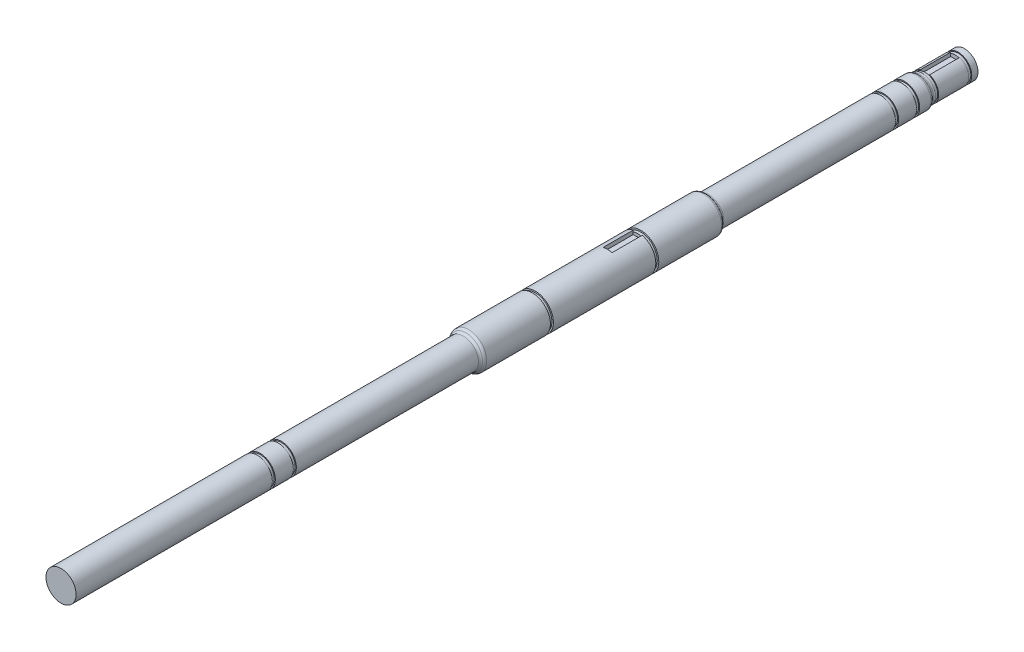
from build123d import *

# Parameters (mm, degrees)
SKETCH7_W           = 10
SKETCH7_H           = 1.5
CUT_EXTRUDE4_DEPTH  = 1.5
SKETCH8_W           = 10
SKETCH8_H           = 1.5
CUT_EXTRUDE5_DEPTH  = 1.5
SKETCH11_W          = 1
SKETCH11_H          = 0.35
SKETCH12_W          = 1
SKETCH12_H          = 0.35
SKETCH14_R          = 6
BOSS_EXTRUDE1_DEPTH = 20
BOSS_EXTRUDE2_START = 20
SKETCH15_R          = 6
BOSS_EXTRUDE2_DEPTH = 20
SKETCH18_W          = 1
SKETCH18_H          = 0.35
SKETCH19_W          = 1
SKETCH19_H          = 0.35
SKETCH22_W          = 0.996061345
SKETCH22_H          = 0.5
SKETCH26_W          = 1.000081644
SKETCH26_H          = 0.3
SKETCH27_W          = 1.000526486
SKETCH27_H          = 0.3
SKETCH29_W          = 1
SKETCH29_H          = 0.5
FILLET2_R           = 1
FILLET3_R           = 1
FILLET4_R           = 1
FILLET5_R           = 1
FILLET6_R           = 1
FILLET7_R           = 1


# Some blends are built 0.0001 mm under size
with BuildPart() as part:
    # Sketch1 → Revolve1 (revolve)
    with BuildSketch(Plane(origin=(0, 0, 0), x_dir=(0, 0, -1), z_dir=(1, 0, 0)), mode=Mode.PRIVATE) as revolve1_sk:
        Polygon((-134.992104591, 0), (165.007895409, 0), (165.007895409, 4.5), (149.357384883, 4.5), (149.357384883, 5), (59.357384883, 5), (59.357384883, 6), (19.357384883, 6), (19.357384883, 5), (-134.992104591, 5), align=None)
    revolve(revolve1_sk.sketch.rotate(Axis((0, 0, 134.992104591), (0, 0, -1)), 90), axis=Axis((0, 0, 134.992104591), (0, 0, -1)))

    # Sketch7 → Cut-Extrude4 (cut, symmetric)
    with BuildSketch(Plane(origin=(0, 0, 0), x_dir=(0, 0, -1), z_dir=(1, 0, 0))):
        with Locations((51.512242661, 5.25)):
            Rectangle(SKETCH7_W, SKETCH7_H)
    extrude(amount=CUT_EXTRUDE4_DEPTH, both=True, mode=Mode.SUBTRACT)

    # Sketch8 → Cut-Extrude5 (cut, symmetric)
    with BuildSketch(Plane(origin=(0, 0, 0), x_dir=(0, 0, -1), z_dir=(1, 0, 0))):
        with Locations((156.934482796, 3.75)):
            Rectangle(SKETCH8_W, SKETCH8_H)
    extrude(amount=CUT_EXTRUDE5_DEPTH, both=True, mode=Mode.SUBTRACT)

    # Cut-Sweep1: sweep along a path in Sketch10
    with BuildLine(Plane(origin=(0, 0, -137.647384883), x_dir=(-1, 0, 0), z_dir=(0, 0, -1))) as cut_sweep1_path:
        CenterArc((0, 0), 5, 0, 360)
    # Sketch11 → Cut-Sweep1 (sweep, cut)
    with BuildSketch(Plane(origin=(0, 0, 0), x_dir=(0, 0, -1), z_dir=(1, 0, 0))):
        with Locations((137.649818054, 4.825)):
            Rectangle(SKETCH11_W, SKETCH11_H)
    sweep(path=cut_sweep1_path.line, mode=Mode.SUBTRACT)

    # Cut-Sweep2: sweep along a path in Sketch9
    with BuildLine(Plane(origin=(0, 0, -144.647384883), x_dir=(-1, 0, 0), z_dir=(0, 0, -1))) as cut_sweep2_path:
        CenterArc((0, 0), 5, 0, 360)
    # Sketch12 → Cut-Sweep2 (sweep, cut)
    with BuildSketch(Plane(origin=(0, 0, 0), x_dir=(0, 0, -1), z_dir=(1, 0, 0))):
        with Locations((144.648120844, 4.825)):
            Rectangle(SKETCH12_W, SKETCH12_H)
    sweep(path=cut_sweep2_path.line, mode=Mode.SUBTRACT)

    # Sketch14 → Boss-Extrude1 (add)
    with BuildSketch(Plane(origin=(0, 0, -59.357384883), x_dir=(-1, 0, 0), z_dir=(0, 0, -1))):
        with Locations(Location((0, 0, 0), (0, 0, 180))):
            Circle(SKETCH14_R)
    extrude(amount=BOSS_EXTRUDE1_DEPTH)

    # Sketch15 → Boss-Extrude2 (add)
    with BuildSketch(Plane.XY.offset(-19.357384883).offset(BOSS_EXTRUDE2_START)):
        Circle(SKETCH15_R)
    extrude(amount=-BOSS_EXTRUDE2_DEPTH)

    # Cut-Sweep3: sweep along a path in Sketch16
    with BuildLine(Plane(origin=(0, 0, 62.352615117), x_dir=(-1, 0, 0), z_dir=(0, 0, -1))) as cut_sweep3_path:
        CenterArc((0, 0), 5, 0, 360)
    # Sketch18 → Cut-Sweep3 (sweep, cut)
    with BuildSketch(Plane(origin=(0, 0, 0), x_dir=(0, 0, -1), z_dir=(1, 0, 0))):
        with Locations((-62.354294527, 4.825)):
            Rectangle(SKETCH18_W, SKETCH18_H)
    sweep(path=cut_sweep3_path.line, mode=Mode.SUBTRACT)

    # Cut-Sweep4: sweep along a path in Sketch17
    with BuildLine(Plane(origin=(0, 0, 69.352615117), x_dir=(-1, 0, 0), z_dir=(0, 0, -1))) as cut_sweep4_path:
        CenterArc((0, 0), 5, 0, 360)
    # Sketch19 → Cut-Sweep4 (sweep, cut)
    with BuildSketch(Plane(origin=(0, 0, 0), x_dir=(0, 0, -1), z_dir=(1, 0, 0))):
        with Locations((-69.328460844, 4.825)):
            Rectangle(SKETCH19_W, SKETCH19_H)
    sweep(path=cut_sweep4_path.line, mode=Mode.SUBTRACT)

    # Cut-Sweep5: sweep along a path in Sketch20
    with BuildLine(Plane.XY.offset(-57.012242661)) as cut_sweep5_path:
        CenterArc((0, 0), 6, 0, 360)
    # Sketch22 → Cut-Sweep5 (sweep, cut)
    with BuildSketch(Plane(origin=(0, 0, 0), x_dir=(0, 0, -1), z_dir=(1, 0, 0))):
        with Locations((57.010273334, 5.75)):
            Rectangle(SKETCH22_W, SKETCH22_H)
    sweep(path=cut_sweep5_path.line, mode=Mode.SUBTRACT)

    # Cut-Sweep7: sweep along a path in Sketch24
    with BuildLine(Plane.XY.offset(-162.434482796)) as cut_sweep7_path:
        CenterArc((0, 0), 4.5, 0, 360)
    # Sketch26 → Cut-Sweep7 (sweep, cut)
    with BuildSketch(Plane(origin=(0, 0, 0), x_dir=(0, 0, -1), z_dir=(1, 0, 0))):
        with Locations((162.434523618, 4.35)):
            Rectangle(SKETCH26_W, SKETCH26_H)
    sweep(path=cut_sweep7_path.line, mode=Mode.SUBTRACT)

    # Cut-Sweep8: sweep along a path in Sketch25
    with BuildLine(Plane(origin=(0, 0, -151.434482796), x_dir=(-1, 0, 0), z_dir=(0, 0, -1))) as cut_sweep8_path:
        CenterArc((0, 0), 4.5, 0, 360)
    # Sketch27 → Cut-Sweep8 (sweep, cut)
    with BuildSketch(Plane(origin=(0, 0, 0), x_dir=(0, 0, -1), z_dir=(1, 0, 0))):
        with Locations((151.434219553, 4.35)):
            Rectangle(SKETCH27_W, SKETCH27_H)
    sweep(path=cut_sweep8_path.line, mode=Mode.SUBTRACT)

    # Cut-Sweep9: sweep along a path in Sketch28
    with BuildLine(Plane.XY.offset(-22.012242661)) as cut_sweep9_path:
        CenterArc((0, 0), 6, 0, 360)
    # Sketch29 → Cut-Sweep9 (sweep, cut)
    with BuildSketch(Plane(origin=(0, 0, 0), x_dir=(0, 0, -1), z_dir=(1, 0, 0))):
        with Locations((22.013204975, 5.75)):
            Rectangle(SKETCH29_W, SKETCH29_H)
    sweep(path=cut_sweep9_path.line, mode=Mode.SUBTRACT)

    # Fillet2
    # the kernel refuses this fillet: 1 mm, written as the material it adds along each edge
    with BuildSketch(Plane(origin=(0, 0, -149.357384883), x_dir=(1, 0, 0), z_dir=(0, 1, 0))) as fillet2_piece_1:
        with BuildLine():
            CenterArc((5.5, 0.866025404), FILLET2_R, 180, 60)
            Line((5, 0), (4.99, -0.017320508))
            ThreePointArc((4.99, -0.017320508), (4.75, -0.02), (4.5, -0.02))
            Line((4.5, -0.02), (4.48, 0))
            Line((4.48, 0), (4.48, 0.866025404))
            Line((4.48, 0.866025404), (4.5, 0.866025404))
        make_face()
    revolve(axis=Axis((0, 0, -149.357384883), (0, 0, -1)))

    # Fillet3
    fillet3_edges = [part.edges().sort_by_distance(p)[0] for p in [
        (-5, 0, -149.357384883),
    ]]
    fillet(fillet3_edges, radius=FILLET3_R)

    # Fillet4
    fillet4_edges = [part.edges().sort_by_distance(p)[0] for p in [
        (-6, 0, -79.357384883),
    ]]
    fillet(fillet4_edges, radius=FILLET4_R - 0.0001)  # a hair under: the kernel refuses the full size

    # Fillet5
    fillet5_edges = [part.edges().sort_by_distance(p)[0] for p in [
        (-5, 0, -79.357384883),
    ]]
    fillet(fillet5_edges, radius=FILLET5_R)

    # Fillet6
    fillet6_edges = [part.edges().sort_by_distance(p)[0] for p in [
        (-6, 0, 0.642615117),
    ]]
    fillet(fillet6_edges, radius=FILLET6_R - 0.0001)  # a hair under: the kernel refuses the full size

    # Fillet7
    fillet7_edges = [part.edges().sort_by_distance(p)[0] for p in [
        (-5, 0, 0.642615117),
    ]]
    fillet(fillet7_edges, radius=FILLET7_R)


solid = part.part
